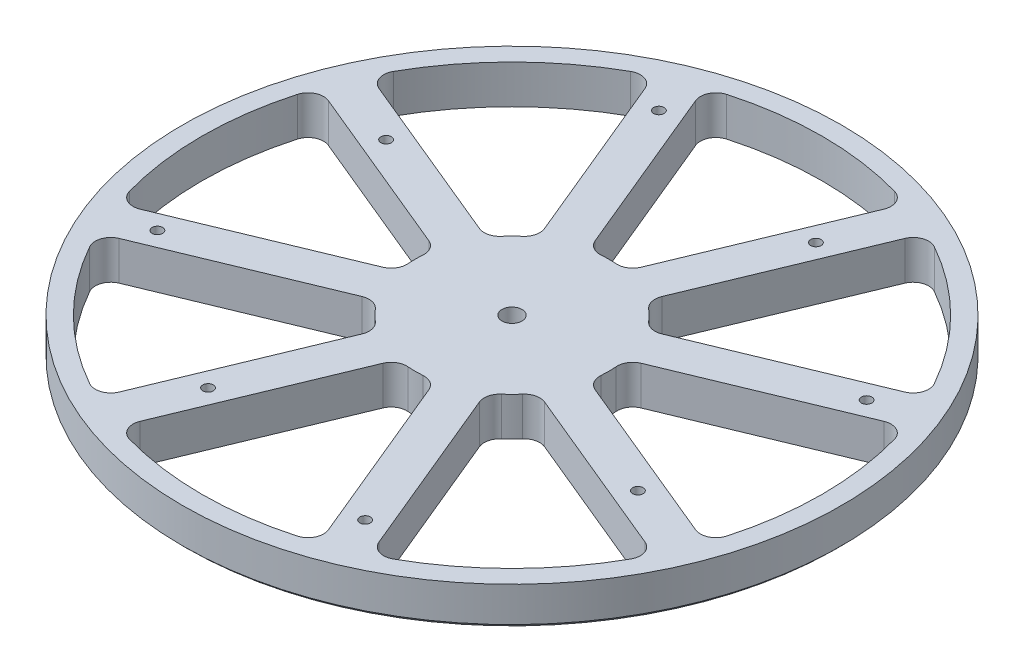
from build123d import *

# Parameters (mm, degrees)
SKETCH2_W                  = 84.99983
SKETCH2_H                  = 10
F_6_32_TAPPED_HOLE1_D      = 2.7051
CIRPATTERN3_COUNT          = 4
CUT_EXTRUDE1_DEPTH         = 121.623141229
FILLET1_R                  = 4
CIRPATTERN4_COUNT          = 8
FILLET1_OF_CIRPATTERN4_R   = 4
CHAMFER2_SIZE              = 1
F_6_0_204_DIAMETER_HOLE2_D = 5.1816


with BuildPart() as part:
    # Sketch2 → Revolve1 (revolve)
    with BuildSketch(Plane(origin=(0, 0, 0), x_dir=(0, 0, -1), z_dir=(1, 0, 0))):
        with Locations((-42.499915, 5)):
            Rectangle(SKETCH2_W, SKETCH2_H)
    revolve(axis=Axis((0, -0.75, 0), (0, 1, 0)))

    # #6-32 Tapped Hole1 (through all)
    with Locations(Plane(origin=(0, 10, 0), x_dir=(1, 0, 0), z_dir=(0, 1, 0))):
        with Locations((-26.787840266, 64.671567276), (-55.432771951, 22.961005942)):
            f_6_32_tapped_hole1 = Hole(F_6_32_TAPPED_HOLE1_D / 2)

    # CirPattern3: #6-32 Tapped Hole1 ×4 about axis
    cirpattern3_axis = Axis((0, -0.75, 0), (0, 1, 0))
    for i in range(1, CIRPATTERN3_COUNT):
        add(f_6_32_tapped_hole1.rotate(cirpattern3_axis, i * 360 / CIRPATTERN3_COUNT), mode=Mode.SUBTRACT)

    # Sketch8 → Cut-Extrude1 (cut, through all)
    with BuildSketch(Plane(origin=(0, 10, 0), x_dir=(1, 0, 0), z_dir=(0, 1, 0))):
        with BuildLine():
            Line((-4.754393761, 24.543751546), (-25.93535895, 75.67912497))
            ThreePointArc((-25.93535895, 75.67912497), (0, 79.99983), (25.93535895, 75.67912497))
            Line((25.93535895, 75.67912497), (4.754393761, 24.543751546))
            ThreePointArc((4.754393761, 24.543751546), (0, 25), (-4.754393761, 24.543751546))
        make_face()
    cut_extrude1 = extrude(amount=-CUT_EXTRUDE1_DEPTH, mode=Mode.SUBTRACT)

    # Fillet1
    fillet1_edges = [part.edges().sort_by_distance(p)[0] for p in [
        (4.754393761, 5, -24.543751546),
        (25.93535895, 5, -75.67912497),
        (-4.754393761, 5, -24.543751546),
        (-25.93535895, 5, -75.67912497),
    ]]
    fillet(fillet1_edges, radius=FILLET1_R)

    # CirPattern4: Cut-Extrude1 ×8 about axis
    cirpattern4_axis = Axis((0, -0.75, 0), (0, 1, 0))
    for i in range(1, CIRPATTERN4_COUNT):
        add(cut_extrude1.rotate(cirpattern4_axis, i * 360 / CIRPATTERN4_COUNT), mode=Mode.SUBTRACT)

    # Fillet1 of CirPattern4
    fillet1_of_cirpattern4_edges = [part.edges().sort_by_distance(p)[0] for p in [
        (-13.993189086, 5, -20.716917223),
        (-35.174154275, 5, -71.852290646),
        (-20.716917223, 5, -13.993189086),
        (-71.852290646, 5, -35.174154275),
        (-24.543751546, 5, -4.754393761),
        (-75.67912497, 5, -25.93535895),
        (-24.543751546, 5, 4.754393761),
        (-75.67912497, 5, 25.93535895),
        (-20.716917223, 5, 13.993189086),
        (-71.852290646, 5, 35.174154275),
        (-13.993189086, 5, 20.716917223),
        (-35.174154275, 5, 71.852290646),
        (-4.754393761, 5, 24.543751546),
        (-25.93535895, 5, 75.67912497),
        (4.754393761, 5, 24.543751546),
        (25.93535895, 5, 75.67912497),
        (13.993189086, 5, 20.716917223),
        (35.174154275, 5, 71.852290646),
        (20.716917223, 5, 13.993189086),
        (71.852290646, 5, 35.174154275),
        (24.543751546, 5, 4.754393761),
        (75.67912497, 5, 25.93535895),
        (24.543751546, 5, -4.754393761),
        (75.67912497, 5, -25.93535895),
        (20.716917223, 5, -13.993189086),
        (71.852290646, 5, -35.174154275),
        (13.993189086, 5, -20.716917223),
        (35.174154275, 5, -71.852290646),
    ]]
    fillet(fillet1_of_cirpattern4_edges, radius=FILLET1_OF_CIRPATTERN4_R)

    # Chamfer2
    chamfer2_edges = [part.edges().sort_by_distance(p)[0] for p in [
        (0, 0, -84.99983),
    ]]
    chamfer(chamfer2_edges, length=CHAMFER2_SIZE)

    # #6 (0.204) Diameter Hole2 (through all)
    with Locations(Plane(origin=(0, 0, 0), x_dir=(-1, 0, 0), z_dir=(0, -1, 0))):
        with Locations((0, 0)):
            Hole(F_6_0_204_DIAMETER_HOLE2_D / 2)


solid = part.part
